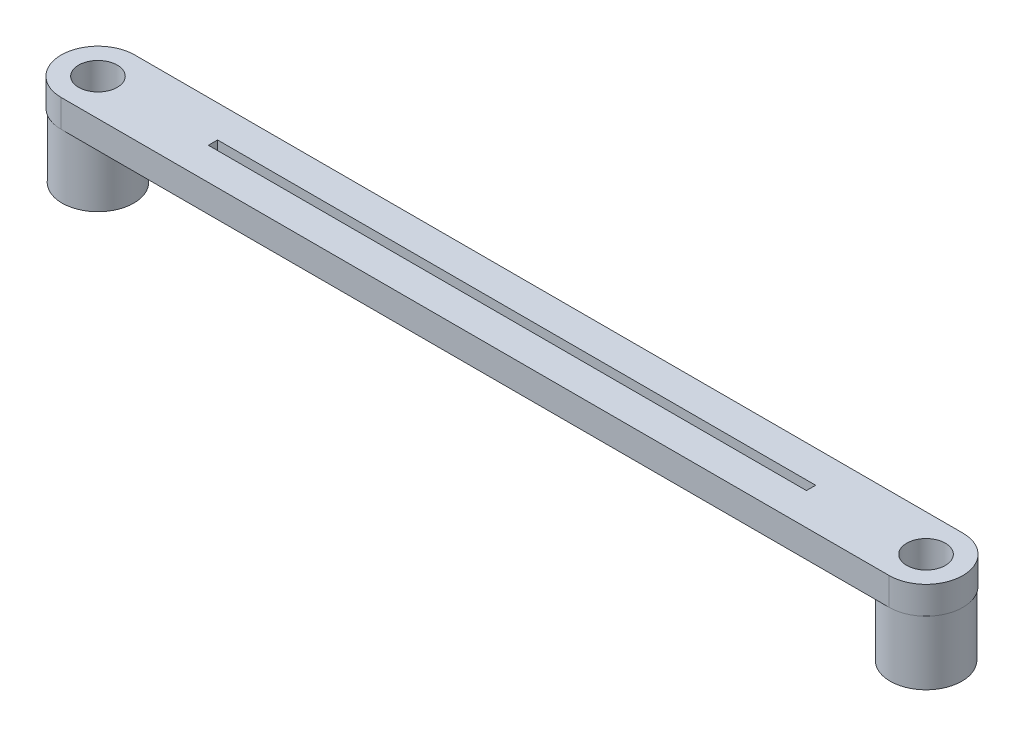
from build123d import *

# Parameters (mm, degrees)
SKETCH1_R           = 2.1
BOSS_EXTRUDE1_DEPTH = 3
SKETCH2_R           = 3.9
SKETCH2_R_2         = 2.1
EXTRUDE_THIN1_DEPTH = 7
SKETCH3_W           = 65
SKETCH3_H           = 1
CUT_EXTRUDE1_DEPTH  = 1


with BuildPart() as part:
    # Sketch1 → Boss-Extrude1 (new body)
    with BuildSketch(Plane(origin=(0, 0, 0), x_dir=(1, 0, 0), z_dir=(0, 1, 0))):
        with BuildLine():
            Line((-45, 4), (45, 4))
            ThreePointArc((45, 4), (49, 0), (45, -4))
            Line((45, -4), (-45, -4))
            ThreePointArc((-45, -4), (-49, 0), (-45, 4))
        make_face()
        with Locations((-45, 0)):
            Circle(SKETCH1_R, mode=Mode.SUBTRACT)
        with Locations((45, 0)):
            Circle(SKETCH1_R, mode=Mode.SUBTRACT)
    extrude(amount=-BOSS_EXTRUDE1_DEPTH)

    # Sketch2 → Extrude-Thin1 (add)
    # profile 1 of 2: a face of its own
    with BuildSketch(Plane.XZ.offset(3)):
        with Locations((45, 0)):
            Circle(SKETCH2_R)
        with Locations((45, 0)):
            Circle(SKETCH2_R_2, mode=Mode.SUBTRACT)
    # profile 2 of 2: a face of its own
    with BuildSketch(Plane.XZ.offset(3)):
        with Locations((-45, 0)):
            Circle(SKETCH2_R)
        with Locations((-45, 0)):
            Circle(SKETCH2_R_2, mode=Mode.SUBTRACT)
    extrude(amount=EXTRUDE_THIN1_DEPTH)

    # Sketch3 → Cut-Extrude1 (cut)
    with BuildSketch(Plane(origin=(0, 0, 0), x_dir=(1, 0, 0), z_dir=(0, 1, 0))):
        Rectangle(SKETCH3_W, SKETCH3_H)
    extrude(amount=-CUT_EXTRUDE1_DEPTH, mode=Mode.SUBTRACT)


solid = part.part
